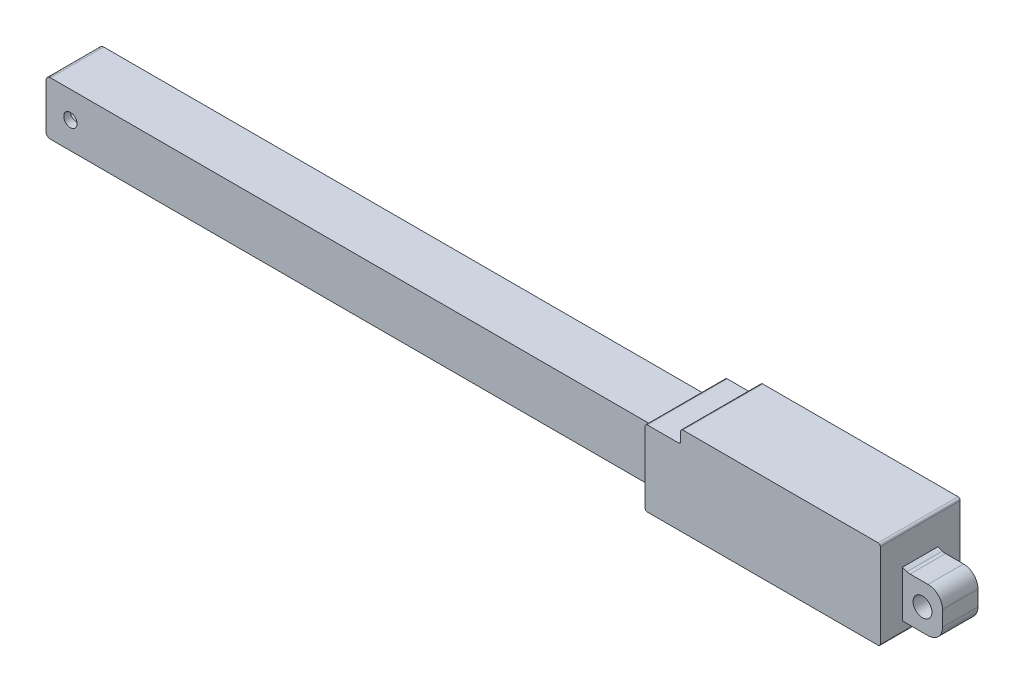
from build123d import *

# Parameters (mm, degrees)
SKETCH2_R           = 2.125
BOSS_EXTRUDE1_DEPTH = 9
SKETCH2_3_W         = 136
SKETCH2_3_H         = 12
SKETCH2_3_R         = 1.5
BOSS_EXTRUDE2_DEPTH = 6
BOSS_EXTRUDE3_DEPTH = 6
SKETCH2_5_R         = 2.125
BOSS_EXTRUDE4_DEPTH = 4.5
SKETCH7_R           = 4.5
CUT_EXTRUDE4_DEPTH  = 138
CUT_EXTRUDE6_DEPTH  = 5
CUT_EXTRUDE7_DEPTH  = 5


with BuildPart() as part:
    # Sketch2 → Boss-Extrude1 (new, symmetric)
    with BuildSketch(Plane.XY):
        with BuildLine():
            Line((138, 14), (138, 12))
            Line((138, 12), (138, 0))
            Line((138, 0), (138, -2))
            ThreePointArc((138, -2), (138.146446609, -2.353553391), (138.5, -2.5))
            Line((138.5, -2.5), (190.5, -2.5))
            ThreePointArc((190.5, -2.5), (190.853553391, -2.353553391), (191, -2))
            Line((191, -2), (191, 0))
            Line((191, 0), (196.731658699, 0))
            ThreePointArc((196.731658699, 0), (199.042724996, 0.957275004), (200, 3.268341301))
            Line((200, 3.268341301), (200, 6.731658699))
            ThreePointArc((200, 6.731658699), (199.042724996, 9.042724996), (196.731658699, 10))
            Line((196.731658699, 10), (192.699864582, 10))
            ThreePointArc((192.699864582, 10), (192.344266481, 10.031866369), (192, 10.126450009))
            Line((192, 10.126450009), (191, 10.5))
            Line((191, 10.5), (191, 17))
            ThreePointArc((191, 17), (190.853553391, 17.353553391), (190.5, 17.5))
            Line((190.5, 17.5), (146.5, 17.5))
            ThreePointArc((146.5, 17.5), (146.146446609, 17.353553391), (146, 17))
            Line((146, 17), (146, 15))
            ThreePointArc((146, 15), (145.853553391, 14.646446609), (145.5, 14.5))
            Line((145.5, 14.5), (138.5, 14.5))
            ThreePointArc((138.5, 14.5), (138.146446609, 14.353553391), (138, 14))
        make_face()
        with Locations((195.5, 5)):
            Circle(SKETCH2_R, mode=Mode.SUBTRACT)
    extrude(amount=BOSS_EXTRUDE1_DEPTH, both=True)

    # Sketch2<3> → Boss-Extrude2 (add, symmetric)
    with BuildSketch(Plane.XY):
        with Locations((70, 6)):
            Rectangle(SKETCH2_3_W, SKETCH2_3_H)
        with Locations((5.5, 6)):
            Circle(SKETCH2_3_R, mode=Mode.SUBTRACT)
    extrude(amount=BOSS_EXTRUDE2_DEPTH, both=True)

    # Sketch2<4> → Boss-Extrude3 (add, symmetric)
    with BuildSketch(Plane.XY):
        with BuildLine():
            Line((2, 0), (2, 12))
            Line((2, 12), (1, 12))
            ThreePointArc((1, 12), (0.292893219, 11.707106781), (0, 11))
            Line((0, 11), (0, 1))
            ThreePointArc((0, 1), (0.292893219, 0.292893219), (1, 0))
            Line((1, 0), (2, 0))
        make_face()
    extrude(amount=BOSS_EXTRUDE3_DEPTH, both=True)

    # Sketch2<5> → Boss-Extrude4 (add, symmetric)
    with BuildSketch(Plane.XY):
        with BuildLine():
            Line((138, 14), (138, 12))
            Line((138, 12), (138, 0))
            Line((138, 0), (138, -2))
            ThreePointArc((138, -2), (138.146446609, -2.353553391), (138.5, -2.5))
            Line((138.5, -2.5), (190.5, -2.5))
            ThreePointArc((190.5, -2.5), (190.853553391, -2.353553391), (191, -2))
            Line((191, -2), (191, 0))
            Line((191, 0), (196.731658699, 0))
            ThreePointArc((196.731658699, 0), (199.042724996, 0.957275004), (200, 3.268341301))
            Line((200, 3.268341301), (200, 6.731658699))
            ThreePointArc((200, 6.731658699), (199.042724996, 9.042724996), (196.731658699, 10))
            Line((196.731658699, 10), (192.699864582, 10))
            ThreePointArc((192.699864582, 10), (192.344266481, 10.031866369), (192, 10.126450009))
            Line((192, 10.126450009), (191, 10.5))
            Line((191, 10.5), (191, 17))
            ThreePointArc((191, 17), (190.853553391, 17.353553391), (190.5, 17.5))
            Line((190.5, 17.5), (146.5, 17.5))
            ThreePointArc((146.5, 17.5), (146.146446609, 17.353553391), (146, 17))
            Line((146, 17), (146, 15))
            ThreePointArc((146, 15), (145.853553391, 14.646446609), (145.5, 14.5))
            Line((145.5, 14.5), (138.5, 14.5))
            ThreePointArc((138.5, 14.5), (138.146446609, 14.353553391), (138, 14))
        make_face()
        with Locations((195.5, 5)):
            Circle(SKETCH2_5_R, mode=Mode.SUBTRACT)
    extrude(amount=BOSS_EXTRUDE4_DEPTH, both=True)

    # Sketch7 → Cut-Extrude4 (cut)
    with BuildSketch(Plane.ZY):
        with Locations((0, 6)):
            Circle(SKETCH7_R)
    extrude(amount=-CUT_EXTRUDE4_DEPTH, mode=Mode.SUBTRACT)

    # Sketch8 → Cut-Extrude6 (cut, symmetric)
    with BuildSketch(Plane.XY.offset(9)):
        Polygon((191, 10.5), (211.452070609, 15.905902501), (206.57065217, -3.8477395), (191, 0), align=None)
    extrude(amount=CUT_EXTRUDE6_DEPTH, both=True, mode=Mode.SUBTRACT)

    # Sketch10 → Cut-Extrude7 (cut, symmetric)
    with BuildSketch(Plane(origin=(0, 0, -9), x_dir=(-1, 0, 0), z_dir=(0, 0, -1))):
        Polygon((-191, 10.5), (-205.235626799, 19.906558274), (-199.172002443, -6.363649676), (-191, 0), align=None)
    extrude(amount=CUT_EXTRUDE7_DEPTH, both=True, mode=Mode.SUBTRACT)


solid = part.part
